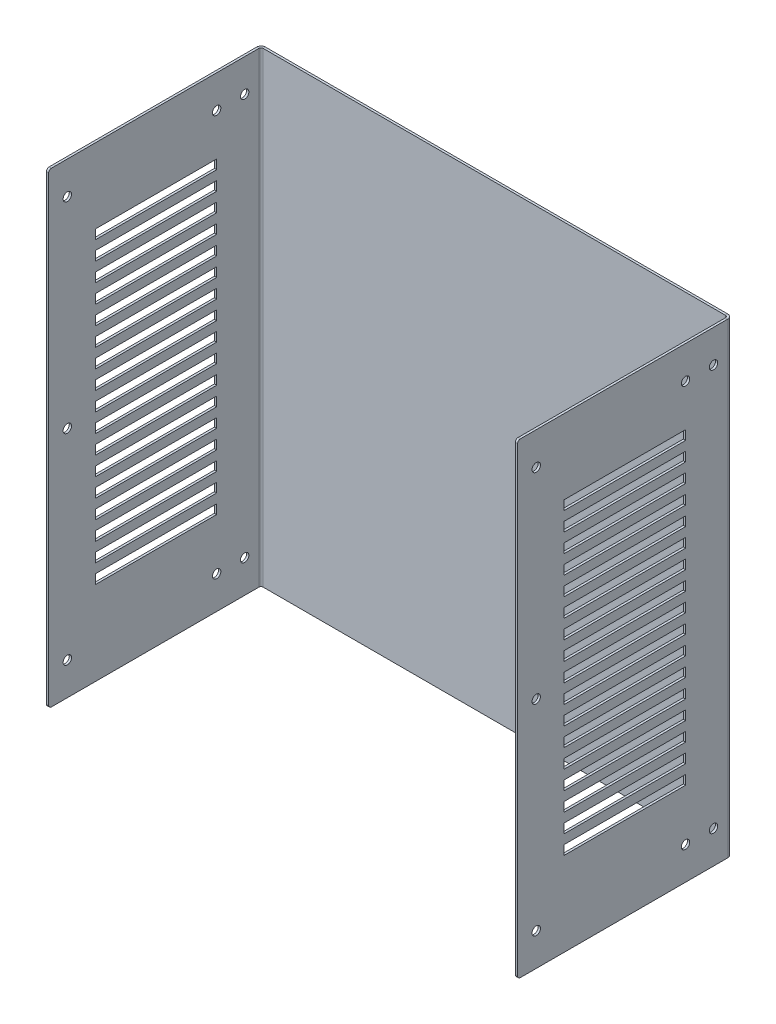
from build123d import *
from build123d.topology import SkipClean

# Parameters (mm, degrees)
SKETCH1_W                  = 478.036
SKETCH1_H                  = 250
BASE_FLANGE1_DEPTH         = 1.2192
FILLET1_R                  = 1.5
SKETCHED_START             = 125.970122508
SKETCHED_BEND1_OUTLINE_W   = 250
SKETCHED_BEND1_OUTLINE_H   = 1.2192
SKETCHED_BEND1_DEPTH       = 113.047877492
SKETCHED_START_2           = -239.018
SKETCHED_BEND1_2_OUTLINE_W = 250
SKETCHED_BEND1_2_OUTLINE_H = 1.2192
SKETCHED_BEND1_2_DEPTH     = 113.021326364
SKETCHED_START_3           = -125.051793636
SKETCHED_BEND1_3_DEPTH     = 0.051375564
SKETCHED_START_4           = 125.000418072
SKETCHED_BEND1_4_DEPTH     = 0.024824436
SKETCHED_START_5           = -125
SKETCHED_BEND1_5_DEPTH     = 250
SKETCHED_BEND1_6_DEPTH     = 250
SKETCHED_START_6           = -127
SKETCHED_BEND1_7_DEPTH     = 254
SKETCH7_W                  = 64.999618072
SKETCH7_H                  = 5
CUT_EXTRUDE1_DEPTH         = 269
SKETCH8_R                  = 2.25
CUT_EXTRUDE2_DEPTH         = 338


with BuildPart() as part:
    # Base-Flange1: sheet metal written as solids
    # Sketch1 → Base-Flange1 (new body)
    with BuildSketch(Plane.XY):
        Rectangle(SKETCH1_W, SKETCH1_H)
    extrude(amount=-BASE_FLANGE1_DEPTH)

    # Fillet1
    fillet1_edges = [part.edges().sort_by_distance(p)[0] for p in [
        (239.018, -125, -0.6096),
        (-239.018, -125, -0.6096),
        (-239.018, 125, -0.6096),
        (239.018, 125, -0.6096),
    ]]
    fillet(fillet1_edges, radius=FILLET1_R)

    # Sketched Bend1: read off the stored shape, not the designer's step
    # Sketched Bend1 outline → Sketched Bend1 (cut)
    with BuildSketch(Plane.YZ.offset(SKETCHED_START)):
        with Locations((0, -0.6096)):
            Rectangle(SKETCHED_BEND1_OUTLINE_W, SKETCHED_BEND1_OUTLINE_H)
    extrude(amount=SKETCHED_BEND1_DEPTH, mode=Mode.SUBTRACT)

    # Sketched Bend1 2 outline → Sketched Bend1 2 (cut)
    with BuildSketch(Plane.YZ.offset(SKETCHED_START_2)):
        with Locations((0, -0.6096)):
            Rectangle(SKETCHED_BEND1_2_OUTLINE_W, SKETCHED_BEND1_2_OUTLINE_H)
    extrude(amount=SKETCHED_BEND1_2_DEPTH, mode=Mode.SUBTRACT)

    # Sketched Bend1 3 outline → Sketched Bend1 3 (add)
    with BuildSketch(Plane.YZ.offset(SKETCHED_START_3)):
        with BuildLine():
            Line((-125, 112.280418072), (-125, 0))
            Line((-125, 0), (125, 0))
            Line((125, 0), (125, 112.280418072))
            ThreePointArc((125, 112.280418072), (124.560660172, 113.341078244), (123.5, 113.780418072))
            Line((123.5, 113.780418072), (-123.5, 113.780418072))
            ThreePointArc((-123.5, 113.780418072), (-124.560660172, 113.341078244), (-125, 112.280418072))
        make_face()
    extrude(amount=SKETCHED_BEND1_3_DEPTH)

    # Sketched Bend1 4 outline → Sketched Bend1 4 (add)
    with BuildSketch(Plane.YZ.offset(SKETCHED_START_4)):
        with BuildLine():
            Line((-125, 112.280418072), (-125, 0))
            Line((-125, 0), (125, 0))
            Line((125, 0), (125, 112.280418072))
            ThreePointArc((125, 112.280418072), (124.560660172, 113.341078244), (123.5, 113.780418072))
            Line((123.5, 113.780418072), (-123.5, 113.780418072))
            ThreePointArc((-123.5, 113.780418072), (-124.560660172, 113.341078244), (-125, 112.280418072))
        make_face()
    extrude(amount=SKETCHED_BEND1_4_DEPTH)

    # Sketched Bend1 5 outline → Sketched Bend1 5 (cut)
    with BuildSketch(Plane(origin=(0, 0, 0), x_dir=(1, 0, 0), z_dir=(0, 1, 0)).offset(SKETCHED_START_5)):
        with BuildLine():
            ThreePointArc((-125.924672251, 0), (-125.057416872, 0.89169696), (-123.857418072, 1.2192))
            Line((-123.857418072, 1.2192), (-125.996673636, 1.2192))
            Line((-125.996673636, 1.2192), (-125.996673636, 0))
            Line((-125.996673636, 0), (-125.924672251, 0))
        make_face()
        with BuildLine():
            Line((125.970122508, 1.2192), (123.857418072, 1.2192))
            ThreePointArc((123.857418072, 1.2192), (125.057416872, 0.89169696), (125.924672251, 0))
            Line((125.924672251, 0), (125.970122508, 0))
            Line((125.970122508, 0), (125.970122508, 1.2192))
        make_face()
    extrude(amount=SKETCHED_BEND1_5_DEPTH, mode=Mode.SUBTRACT)

    # Sketched Bend1 6 outline → Sketched Bend1 6 (add)
    with BuildSketch(Plane(origin=(0, 0, 0), x_dir=(1, 0, 0), z_dir=(0, 1, 0)).offset(SKETCHED_START_5)):
        with BuildLine():
            Line((-125.051793636, 0), (-125.924672251, 0))
            ThreePointArc((-125.924672251, 0), (-126.144693379, -0.552779271), (-126.219618072, -1.143))
            Line((-126.219618072, -1.143), (-126.219618072, -113.780418072))
            Line((-126.219618072, -113.780418072), (-125.051793636, -113.780418072))
            Line((-125.051793636, -113.780418072), (-125.051793636, 0))
        make_face()
        with BuildLine():
            ThreePointArc((126.219618072, -1.143), (126.144693379, -0.552779271), (125.924672251, 0))
            Line((125.924672251, 0), (125.025242508, 0))
            Line((125.025242508, 0), (125.025242508, -113.780418072))
            Line((125.025242508, -113.780418072), (126.219618072, -113.780418072))
            Line((126.219618072, -113.780418072), (126.219618072, -1.143))
        make_face()
        with BuildLine():
            Line((-125.000418072, 0), (-125.000418072, -1.143))
            ThreePointArc((-125.000418072, -1.143), (-124.665641123, -0.334776949), (-123.857418072, 0))
            Line((-123.857418072, 0), (-125.000418072, 0))
        make_face()
        with BuildLine():
            ThreePointArc((123.857418072, 0), (124.665641123, -0.334776949), (125.000418072, -1.143))
            Line((125.000418072, -1.143), (125.000418072, 0))
            Line((125.000418072, 0), (123.857418072, 0))
        make_face()
    extrude(amount=SKETCHED_BEND1_6_DEPTH)

    # Sketched Bend1 7 outline → Sketched Bend1 7 (cut)
    with SkipClean():  # the faces are left unmerged after this step: merging them gives an invalid solid
        with BuildSketch(Plane.YZ.offset(SKETCHED_START_6)):
            with BuildLine():
                ThreePointArc((123.5, 113.780418072), (124.560660172, 113.341078244), (125, 112.280418072))
                Line((125, 112.280418072), (125, 113.780418072))
                Line((125, 113.780418072), (123.5, 113.780418072))
            make_face()
            with BuildLine():
                Line((-125, 113.780418072), (-125, 112.280418072))
                ThreePointArc((-125, 112.280418072), (-124.560660172, 113.341078244), (-123.5, 113.780418072))
                Line((-123.5, 113.780418072), (-125, 113.780418072))
            make_face()
        extrude(amount=SKETCHED_BEND1_7_DEPTH, mode=Mode.SUBTRACT)
    add(part.part.scale(1), mode=Mode.REPLACE)  # the faces are merged on a copy

    # Sketch7 → Cut-Extrude1 (cut)
    with BuildSketch(Plane(origin=(126.219618072, 0, 0), x_dir=(0, 0, -1), z_dir=(1, 0, 0))):
        with Locations((-56.280609036, 82.5)):
            Rectangle(SKETCH7_W, SKETCH7_H)
        with Locations((-56.280609036, 72.5)):
            Rectangle(SKETCH7_W, SKETCH7_H)
        with Locations((-56.280609036, 62.5)):
            Rectangle(SKETCH7_W, SKETCH7_H)
        with Locations((-56.280609036, 52.5)):
            Rectangle(SKETCH7_W, SKETCH7_H)
        with Locations((-56.280609036, 42.5)):
            Rectangle(SKETCH7_W, SKETCH7_H)
        with Locations((-56.280609036, 32.5)):
            Rectangle(SKETCH7_W, SKETCH7_H)
        with Locations((-56.280609036, 22.5)):
            Rectangle(SKETCH7_W, SKETCH7_H)
        with Locations((-56.280609036, 12.5)):
            Rectangle(SKETCH7_W, SKETCH7_H)
        with Locations((-56.280609036, 2.5)):
            Rectangle(SKETCH7_W, SKETCH7_H)
        with Locations((-56.280609036, -7.5)):
            Rectangle(SKETCH7_W, SKETCH7_H)
        with Locations((-56.280609036, -17.5)):
            Rectangle(SKETCH7_W, SKETCH7_H)
        with Locations((-56.280609036, -27.5)):
            Rectangle(SKETCH7_W, SKETCH7_H)
        with Locations((-56.280609036, -37.5)):
            Rectangle(SKETCH7_W, SKETCH7_H)
        with Locations((-56.280609036, -47.5)):
            Rectangle(SKETCH7_W, SKETCH7_H)
        with Locations((-56.280609036, -57.5)):
            Rectangle(SKETCH7_W, SKETCH7_H)
        with Locations((-56.280609036, -67.5)):
            Rectangle(SKETCH7_W, SKETCH7_H)
        with Locations((-56.280609036, -77.5)):
            Rectangle(SKETCH7_W, SKETCH7_H)
    extrude(amount=-CUT_EXTRUDE1_DEPTH, mode=Mode.SUBTRACT)

    # Sketch8 → Cut-Extrude2 (cut)
    with BuildSketch(Plane(origin=(126.219618072, 0, 0), x_dir=(0, 0, -1), z_dir=(1, 0, 0))):
        with Locations((-103.780418072, 107.5)):
            Circle(SKETCH8_R)
        with Locations((-103.780418072, -107.5)):
            Circle(SKETCH8_R)
        with Locations((-8.7808, -107.5)):
            Circle(SKETCH8_R)
        with Locations((-23.7808, -107.5)):
            Circle(SKETCH8_R)
        with Locations((-8.7808, 107.5)):
            Circle(SKETCH8_R)
        with Locations((-23.7808, 107.5)):
            Circle(SKETCH8_R)
        with Locations((-103.780418072, 0)):
            Circle(SKETCH8_R)
    extrude(amount=-CUT_EXTRUDE2_DEPTH, mode=Mode.SUBTRACT)


solid = part.part
